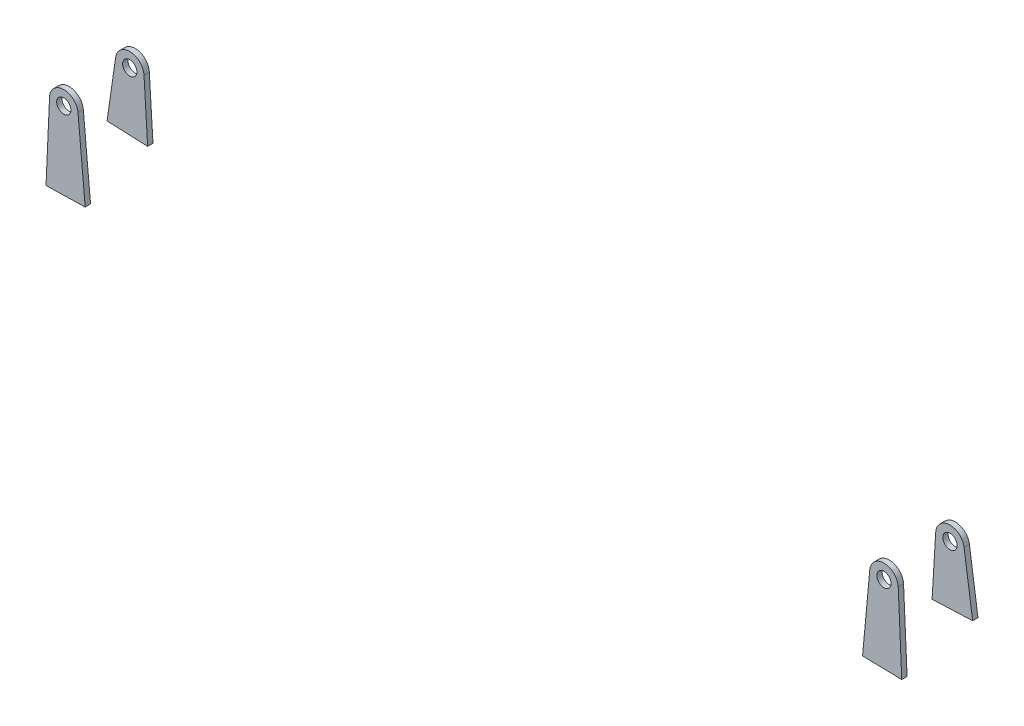
from build123d import *

# Parameters (mm, degrees)
BOSS_EXTRUDE1_START       = 2132
BOSS_EXTRUDE1_OUTLINE_R   = 4
BOSS_EXTRUDE1_DEPTH       = 3
BOSS_EXTRUDE1_START_2     = 2095
BOSS_EXTRUDE1_2_OUTLINE_R = 4
BOSS_EXTRUDE1_2_DEPTH     = 3


# Read off the part's stored shape, not the designer's step: Boss-Extrude1
with BuildPart() as part:
    # Boss-Extrude1 outline → Boss-Extrude1 (new body)
    with BuildSketch(Plane.XY.offset(BOSS_EXTRUDE1_START)):
        with BuildLine():
            ThreePointArc((237.917335534, 344.147082404), (229.791723167, 350.997288338), (222.033689788, 343.73341776))
            Line((222.033689788, 343.73341776), (217.999104301, 299.910154527))
            Line((217.999104301, 299.910154527), (239.977266453, 299.397128138))
            Line((239.977266453, 299.397128138), (237.991854695, 343.360913469))
            ThreePointArc((237.991854695, 343.360913469), (237.964301528, 343.754917985), (237.917335534, 344.147082404))
        make_face()
        with Locations((230, 343)):
            Circle(BOSS_EXTRUDE1_OUTLINE_R, mode=Mode.SUBTRACT)
    extrude(amount=BOSS_EXTRUDE1_DEPTH)


with BuildPart() as body_2:
    # Boss-Extrude1 2 outline → Boss-Extrude1 2 (new body)
    with BuildSketch(Plane.XY.offset(BOSS_EXTRUDE1_START_2)):
        with BuildLine():
            Line((222.014622911, 343.483479836), (219.981515577, 309.903736695))
            Line((219.981515577, 309.903736695), (242.740994086, 310.853464501))
            Line((242.740994086, 310.853464501), (237.917335534, 344.147082404))
            ThreePointArc((237.917335534, 344.147082404), (229.66645914, 350.993043882), (222.014622911, 343.483479836))
        make_face()
        with Locations((230, 343)):
            Circle(BOSS_EXTRUDE1_2_OUTLINE_R, mode=Mode.SUBTRACT)
    extrude(amount=BOSS_EXTRUDE1_2_DEPTH)


with BuildPart() as body_3:
    # Mirror1: mirrored copy
    add(part.part.mirror(Plane(origin=(0, 0, 0), x_dir=(0, 0, 1), z_dir=(1, 0, 0))))


with BuildPart() as body_4:
    # Mirror1 2: mirrored copy
    add(body_2.part.mirror(Plane(origin=(0, 0, 0), x_dir=(0, 0, 1), z_dir=(1, 0, 0))))


solid = Compound([part.part, body_2.part, body_3.part, body_4.part])
